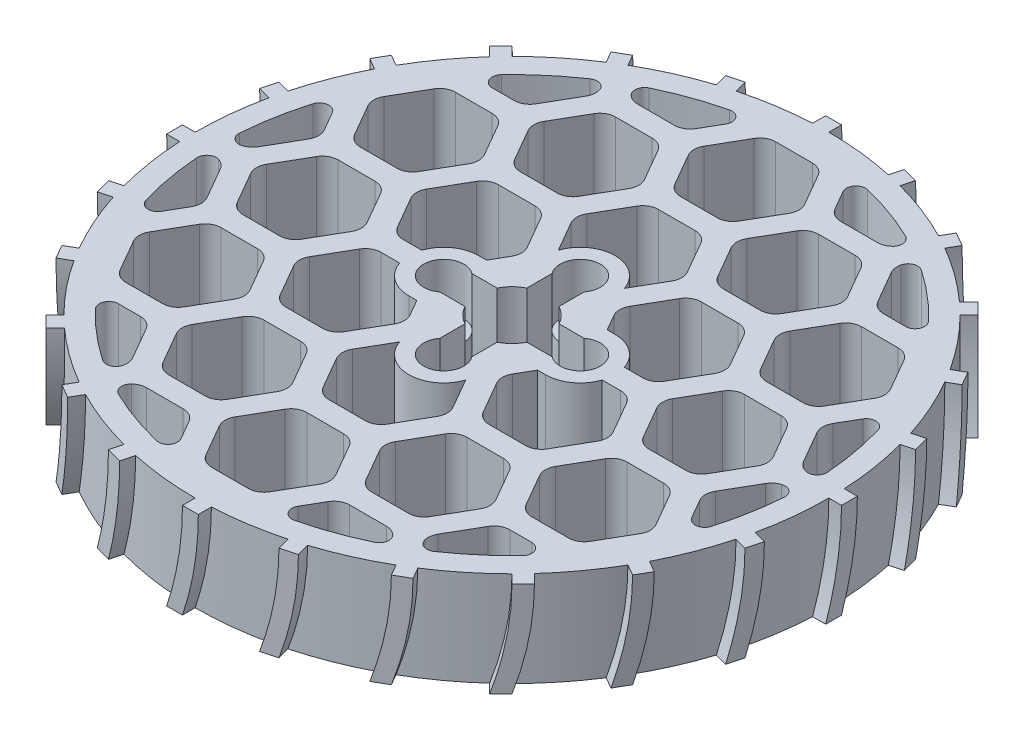
from build123d import *

# Parameters (mm, degrees)
SKETCH3_R           = 100
BOSS_EXTRUDE1_DEPTH = 30
SKETCH3_3_R         = 6.338999989
SKETCH3_3_R_2       = 3.302
BOSS_EXTRUDE2_DEPTH = 15
FILLET2_R           = 3
BOSS_EXTRUDE3_START = -2
BOSS_EXTRUDE3_DEPTH = 6
CIRPATTERN1_COUNT   = 24


with BuildPart() as part:
    # Sketch3 → Boss-Extrude1 (new body)
    with BuildSketch(Plane(origin=(0, 0, 0), x_dir=(1, 0, 0), z_dir=(0, 1, 0))):
        Circle(SKETCH3_R)
        with BuildLine():
            Line((9.767988863, 5.058299474), (17.727459802, 5.058299474))
            ThreePointArc((17.72745979, 5.05829949), (27.886999941, 1.2e-08), (17.727459809, -5.058299505))
            Line((17.727459783, -5.05829954), (9.767988829, -5.05829954))
            ThreePointArc((9.767988829, -5.05829954), (7.778174567, -7.778174619), (5.058299474, -9.767988863))
            Line((5.058299474, -9.767988863), (5.058299474, -17.727459802))
            ThreePointArc((5.05829949, -17.72745979), (1.2e-08, -27.886999941), (-5.058299505, -17.727459809))
            Line((-5.05829954, -17.727459783), (-5.05829954, -9.767988829))
            ThreePointArc((-5.05829954, -9.767988829), (-7.778174619, -7.778174567), (-9.767988863, -5.058299474))
            Line((-9.767988863, -5.058299474), (-17.727459802, -5.058299474))
            ThreePointArc((-17.72745979, -5.05829949), (-27.886999941, -1.2e-08), (-17.727459809, 5.058299505))
            Line((-17.727459783, 5.05829954), (-9.767988829, 5.05829954))
            ThreePointArc((-9.767988829, 5.05829954), (-7.778174567, 7.778174619), (-5.058299474, 9.767988863))
            Line((-5.058299474, 9.767988863), (-5.058299474, 17.727459802))
            ThreePointArc((-5.05829949, 17.72745979), (-1.2e-08, 27.886999941), (5.058299505, 17.727459809))
            Line((5.05829954, 17.727459783), (5.05829954, 9.767988829))
            ThreePointArc((5.05829954, 9.767988829), (7.778174619, 7.778174567), (9.767988863, 5.058299474))
        make_face(mode=Mode.SUBTRACT)
        with BuildLine():
            ThreePointArc((10.425269447, 25.057096364), (-7e-09, 32.547999916), (-10.425269391, 25.057096268))
            Line((-10.425269391, 25.057096268), (-15.877132403, 34.5))
            ThreePointArc((-15.877132403, 34.5), (-16.547005384, 37), (-15.877132403, 39.5))
            Line((-15.877132403, 39.5), (-10.103629711, 49.5))
            ThreePointArc((-10.103629711, 49.5), (-8.273502692, 51.330127019), (-5.773502692, 52))
            Line((-5.773502692, 52), (5.773502692, 52))
            ThreePointArc((5.773502692, 52), (8.273502692, 51.330127019), (10.103629711, 49.5))
            Line((10.103629711, 49.5), (15.877132403, 39.5))
            ThreePointArc((15.877132403, 39.5), (16.547005384, 37), (15.877132403, 34.5))
            Line((15.877132403, 34.5), (10.425269447, 25.057096364))
        make_face(mode=Mode.SUBTRACT)
        with BuildLine():
            ThreePointArc((86.025190109, 31), (86.543723708, 31.736009208), (87.185842375, 32.367095782))
            ThreePointArc((87.185842375, 32.367095782), (91.209249511, 18.162400823), (92.934116448, 3.5))
            Line((92.934116448, 3.5), (90.355317128, 3.5))
            ThreePointArc((90.355317128, 3.5), (87.855317128, 4.169872981), (86.025190109, 6))
            Line((86.025190109, 6), (80.251687417, 16))
            ThreePointArc((80.251687417, 16), (79.581814436, 18.5), (80.251687417, 21))
            Line((80.251687417, 21), (86.025190109, 31))
        make_face(mode=Mode.SUBTRACT)
        with BuildLine():
            Line((90.355317128, -3.5), (92.934116448, -3.5))
            ThreePointArc((92.934116448, -3.5), (91.209249511, -18.162400823), (87.185842375, -32.367095782))
            ThreePointArc((87.185842375, -32.367095782), (86.543723707, -31.736009208), (86.025190109, -31))
            Line((86.025190109, -31), (80.251687417, -21))
            ThreePointArc((80.251687417, -21), (79.581814436, -18.5), (80.251687417, -16))
            Line((80.251687417, -16), (86.025190109, -6))
            ThreePointArc((86.025190109, -6), (87.855317128, -4.169872981), (90.355317128, -3.5))
        make_face(mode=Mode.SUBTRACT)
        with BuildLine():
            ThreePointArc((69.859382572, -59), (70.756052043, -59.081058665), (71.623648382, -59.321606456))
            ThreePointArc((71.623648382, -59.321606456), (61.333725262, -69.908326725), (49.498147137, -78.733305722))
            Line((49.498147137, -78.733305722), (48.208747477, -76.5))
            ThreePointArc((48.208747477, -76.5), (47.538874496, -74), (48.208747477, -71.5))
            Line((48.208747477, -71.5), (53.982250169, -61.5))
            ThreePointArc((53.982250169, -61.5), (55.812377188, -59.669872981), (58.312377188, -59))
            Line((58.312377188, -59), (69.859382572, -59))
        make_face(mode=Mode.SUBTRACT)
        with BuildLine():
            Line((42.146569651, -80), (43.435969311, -82.233305722))
            ThreePointArc((43.435969311, -82.233305722), (29.875524249, -88.070727548), (15.562193993, -91.688702238))
            ThreePointArc((15.562193993, -91.688702238), (15.787671665, -90.817067873), (16.165807537, -90))
            Line((16.165807537, -90), (21.939310229, -80))
            ThreePointArc((21.939310229, -80), (23.769437248, -78.169872981), (26.269437248, -77.5))
            Line((26.269437248, -77.5), (37.816442632, -77.5))
            ThreePointArc((37.816442632, -77.5), (40.316442632, -78.169872981), (42.146569651, -80))
        make_face(mode=Mode.SUBTRACT)
        with BuildLine():
            ThreePointArc((-16.165807537, -90), (-15.787671665, -90.817067873), (-15.562193993, -91.688702238))
            ThreePointArc((-15.562193993, -91.688702238), (-29.875524249, -88.070727548), (-43.435969311, -82.233305722))
            Line((-43.435969311, -82.233305722), (-42.146569651, -80))
            ThreePointArc((-42.146569651, -80), (-40.316442632, -78.169872981), (-37.816442632, -77.5))
            Line((-37.816442632, -77.5), (-26.269437248, -77.5))
            ThreePointArc((-26.269437248, -77.5), (-23.769437248, -78.169872981), (-21.939310229, -80))
            Line((-21.939310229, -80), (-16.165807537, -90))
        make_face(mode=Mode.SUBTRACT)
        with BuildLine():
            Line((-48.208747477, -76.5), (-49.498147137, -78.733305722))
            ThreePointArc((-49.498147137, -78.733305722), (-61.333725262, -69.908326725), (-71.623648382, -59.321606456))
            ThreePointArc((-71.623648382, -59.321606456), (-70.756052043, -59.081058665), (-69.859382572, -59))
            Line((-69.859382572, -59), (-58.312377188, -59))
            ThreePointArc((-58.312377188, -59), (-55.812377188, -59.669872981), (-53.982250169, -61.5))
            Line((-53.982250169, -61.5), (-48.208747477, -71.5))
            ThreePointArc((-48.208747477, -71.5), (-47.538874496, -74), (-48.208747477, -76.5))
        make_face(mode=Mode.SUBTRACT)
        with BuildLine():
            ThreePointArc((-86.025190109, -31), (-86.543723708, -31.736009208), (-87.185842375, -32.367095782))
            ThreePointArc((-87.185842375, -32.367095782), (-91.209249511, -18.162400823), (-92.934116448, -3.5))
            Line((-92.934116448, -3.5), (-90.355317128, -3.5))
            ThreePointArc((-90.355317128, -3.5), (-87.855317128, -4.169872981), (-86.025190109, -6))
            Line((-86.025190109, -6), (-80.251687417, -16))
            ThreePointArc((-80.251687417, -16), (-79.581814436, -18.5), (-80.251687417, -21))
            Line((-80.251687417, -21), (-86.025190109, -31))
        make_face(mode=Mode.SUBTRACT)
        with BuildLine():
            Line((-90.355317128, 3.5), (-92.934116448, 3.5))
            ThreePointArc((-92.934116448, 3.5), (-91.209249511, 18.162400823), (-87.185842375, 32.367095782))
            ThreePointArc((-87.185842375, 32.367095782), (-86.543723707, 31.736009208), (-86.025190109, 31))
            Line((-86.025190109, 31), (-80.251687417, 21))
            ThreePointArc((-80.251687417, 21), (-79.581814436, 18.5), (-80.251687417, 16))
            Line((-80.251687417, 16), (-86.025190109, 6))
            ThreePointArc((-86.025190109, 6), (-87.855317128, 4.169872981), (-90.355317128, 3.5))
        make_face(mode=Mode.SUBTRACT)
        with BuildLine():
            ThreePointArc((-69.859382572, 59), (-70.756052043, 59.081058665), (-71.623648382, 59.321606456))
            ThreePointArc((-71.623648382, 59.321606456), (-61.333725262, 69.908326725), (-49.498147137, 78.733305722))
            Line((-49.498147137, 78.733305722), (-48.208747477, 76.5))
            ThreePointArc((-48.208747477, 76.5), (-47.538874496, 74), (-48.208747477, 71.5))
            Line((-48.208747477, 71.5), (-53.982250169, 61.5))
            ThreePointArc((-53.982250169, 61.5), (-55.812377188, 59.669872981), (-58.312377188, 59))
            Line((-58.312377188, 59), (-69.859382572, 59))
        make_face(mode=Mode.SUBTRACT)
        with BuildLine():
            Line((-42.146569651, 80), (-43.435969311, 82.233305722))
            ThreePointArc((-43.435969311, 82.233305722), (-29.875524249, 88.070727548), (-15.562193993, 91.688702238))
            ThreePointArc((-15.562193993, 91.688702238), (-15.787671665, 90.817067873), (-16.165807537, 90))
            Line((-16.165807537, 90), (-21.939310229, 80))
            ThreePointArc((-21.939310229, 80), (-23.769437248, 78.169872981), (-26.269437248, 77.5))
            Line((-26.269437248, 77.5), (-37.816442632, 77.5))
            ThreePointArc((-37.816442632, 77.5), (-40.316442632, 78.169872981), (-42.146569651, 80))
        make_face(mode=Mode.SUBTRACT)
        with BuildLine():
            ThreePointArc((16.165807537, 90), (15.787671665, 90.817067873), (15.562193993, 91.688702238))
            ThreePointArc((15.562193993, 91.688702238), (29.875524249, 88.070727548), (43.435969311, 82.233305722))
            Line((43.435969311, 82.233305722), (42.146569651, 80))
            ThreePointArc((42.146569651, 80), (40.316442632, 78.169872981), (37.816442632, 77.5))
            Line((37.816442632, 77.5), (26.269437248, 77.5))
            ThreePointArc((26.269437248, 77.5), (23.769437248, 78.169872981), (21.939310229, 80))
            Line((21.939310229, 80), (16.165807537, 90))
        make_face(mode=Mode.SUBTRACT)
        with BuildLine():
            Line((48.208747477, 76.5), (49.498147137, 78.733305722))
            ThreePointArc((49.498147137, 78.733305722), (61.333725262, 69.908326725), (71.623648382, 59.321606456))
            ThreePointArc((71.623648382, 59.321606456), (70.756052043, 59.081058665), (69.859382572, 59))
            Line((69.859382572, 59), (58.312377188, 59))
            ThreePointArc((58.312377188, 59), (55.812377188, 59.669872981), (53.982250169, 61.5))
            Line((53.982250169, 61.5), (48.208747477, 71.5))
            ThreePointArc((48.208747477, 71.5), (47.538874496, 74), (48.208747477, 76.5))
        make_face(mode=Mode.SUBTRACT)
        with BuildLine():
            Line((-26.269437248, -70.5), (-37.816442632, -70.5))
            ThreePointArc((-37.816442632, -70.5), (-40.316442632, -69.830127019), (-42.146569651, -68))
            Line((-42.146569651, -68), (-47.920072343, -58))
            ThreePointArc((-47.920072343, -58), (-48.589945324, -55.5), (-47.920072343, -53))
            Line((-47.920072343, -53), (-42.146569651, -43))
            ThreePointArc((-42.146569651, -43), (-40.316442632, -41.169872981), (-37.816442632, -40.5))
            Line((-37.816442632, -40.5), (-26.269437248, -40.5))
            ThreePointArc((-26.269437248, -40.5), (-23.769437248, -41.169872981), (-21.939310229, -43))
            Line((-21.939310229, -43), (-16.165807537, -53))
            ThreePointArc((-16.165807537, -53), (-15.495934556, -55.5), (-16.165807537, -58))
            Line((-16.165807537, -58), (-21.939310229, -68))
            ThreePointArc((-21.939310229, -68), (-23.769437248, -69.830127019), (-26.269437248, -70.5))
        make_face(mode=Mode.SUBTRACT)
        with BuildLine():
            Line((15.877132403, -76.5), (10.103629711, -86.5))
            ThreePointArc((10.103629711, -86.5), (8.273502692, -88.330127019), (5.773502692, -89))
            Line((5.773502692, -89), (-5.773502692, -89))
            ThreePointArc((-5.773502692, -89), (-8.273502692, -88.330127019), (-10.103629711, -86.5))
            Line((-10.103629711, -86.5), (-15.877132403, -76.5))
            ThreePointArc((-15.877132403, -76.5), (-16.547005384, -74), (-15.877132403, -71.5))
            Line((-15.877132403, -71.5), (-10.103629711, -61.5))
            ThreePointArc((-10.103629711, -61.5), (-8.273502692, -59.669872981), (-5.773502692, -59))
            Line((-5.773502692, -59), (5.773502692, -59))
            ThreePointArc((5.773502692, -59), (8.273502692, -59.669872981), (10.103629711, -61.5))
            Line((10.103629711, -61.5), (15.877132403, -71.5))
            ThreePointArc((15.877132403, -71.5), (16.547005384, -74), (15.877132403, -76.5))
        make_face(mode=Mode.SUBTRACT)
        with BuildLine():
            Line((-58.312377188, -52), (-69.859382572, -52))
            ThreePointArc((-69.859382572, -52), (-72.359382572, -51.330127019), (-74.189509591, -49.5))
            Line((-74.189509591, -49.5), (-79.963012283, -39.5))
            ThreePointArc((-79.963012283, -39.5), (-80.632885264, -37), (-79.963012283, -34.5))
            Line((-79.963012283, -34.5), (-74.189509591, -24.5))
            ThreePointArc((-74.189509591, -24.5), (-72.359382572, -22.669872981), (-69.859382572, -22))
            Line((-69.859382572, -22), (-58.312377188, -22))
            ThreePointArc((-58.312377188, -22), (-55.812377188, -22.669872981), (-53.982250169, -24.5))
            Line((-53.982250169, -24.5), (-48.208747477, -34.5))
            ThreePointArc((-48.208747477, -34.5), (-47.538874496, -37), (-48.208747477, -39.5))
            Line((-48.208747477, -39.5), (-53.982250169, -49.5))
            ThreePointArc((-53.982250169, -49.5), (-55.812377188, -51.330127019), (-58.312377188, -52))
        make_face(mode=Mode.SUBTRACT)
        with BuildLine():
            Line((-74.189509591, -12.5), (-79.963012283, -2.5))
            ThreePointArc((-79.963012283, -2.5), (-80.632885264, 0), (-79.963012283, 2.5))
            Line((-79.963012283, 2.5), (-74.189509591, 12.5))
            ThreePointArc((-74.189509591, 12.5), (-72.359382572, 14.330127019), (-69.859382572, 15))
            Line((-69.859382572, 15), (-58.312377188, 15))
            ThreePointArc((-58.312377188, 15), (-55.812377188, 14.330127019), (-53.982250169, 12.5))
            Line((-53.982250169, 12.5), (-48.208747477, 2.5))
            ThreePointArc((-48.208747477, 2.5), (-47.538874496, 0), (-48.208747477, -2.5))
            Line((-48.208747477, -2.5), (-53.982250169, -12.5))
            ThreePointArc((-53.982250169, -12.5), (-55.812377188, -14.330127019), (-58.312377188, -15))
            Line((-58.312377188, -15), (-69.859382572, -15))
            ThreePointArc((-69.859382572, -15), (-72.359382572, -14.330127019), (-74.189509591, -12.5))
        make_face(mode=Mode.SUBTRACT)
        with BuildLine():
            Line((47.920072343, -58), (42.146569651, -68))
            ThreePointArc((42.146569651, -68), (40.316442632, -69.830127019), (37.816442632, -70.5))
            Line((37.816442632, -70.5), (26.269437248, -70.5))
            ThreePointArc((26.269437248, -70.5), (23.769437248, -69.830127019), (21.939310229, -68))
            Line((21.939310229, -68), (16.165807537, -58))
            ThreePointArc((16.165807537, -58), (15.495934556, -55.5), (16.165807537, -53))
            Line((16.165807537, -53), (21.939310229, -43))
            ThreePointArc((21.939310229, -43), (23.769437248, -41.169872981), (26.269437248, -40.5))
            Line((26.269437248, -40.5), (37.816442632, -40.5))
            ThreePointArc((37.816442632, -40.5), (40.316442632, -41.169872981), (42.146569651, -43))
            Line((42.146569651, -43), (47.920072343, -53))
            ThreePointArc((47.920072343, -53), (48.589945324, -55.5), (47.920072343, -58))
        make_face(mode=Mode.SUBTRACT)
        with BuildLine():
            ThreePointArc((79.963012283, 39.5), (80.632885264, 37), (79.963012283, 34.5))
            Line((79.963012283, 34.5), (74.189509591, 24.5))
            ThreePointArc((74.189509591, 24.5), (72.359382572, 22.669872981), (69.859382572, 22))
            Line((69.859382572, 22), (58.312377188, 22))
            ThreePointArc((58.312377188, 22), (55.812377188, 22.669872981), (53.982250169, 24.5))
            Line((53.982250169, 24.5), (48.208747477, 34.5))
            ThreePointArc((48.208747477, 34.5), (47.538874496, 37), (48.208747477, 39.5))
            Line((48.208747477, 39.5), (53.982250169, 49.5))
            ThreePointArc((53.982250169, 49.5), (55.812377188, 51.330127019), (58.312377188, 52))
            Line((58.312377188, 52), (69.859382572, 52))
            ThreePointArc((69.859382572, 52), (72.359382572, 51.330127019), (74.189509591, 49.5))
            Line((74.189509591, 49.5), (79.963012283, 39.5))
        make_face(mode=Mode.SUBTRACT)
        with BuildLine():
            Line((-16.165807537, 16), (-19.052558858, 11.000000044))
            Line((-19.052558858, 11.000000044), (-21.547999916, 11.000000044))
            ThreePointArc((-21.547999916, 11.000000044), (-27.970616224, 8.93028558), (-31.976326738, 3.5))
            Line((-31.976326738, 3.5), (-37.816442632, 3.5))
            ThreePointArc((-37.816442632, 3.5), (-40.316442632, 4.169872981), (-42.146569651, 6))
            Line((-42.146569651, 6), (-47.920072343, 16))
            ThreePointArc((-47.920072343, 16), (-48.589945324, 18.5), (-47.920072343, 21))
            Line((-47.920072343, 21), (-42.146569651, 31))
            ThreePointArc((-42.146569651, 31), (-40.316442632, 32.830127019), (-37.816442632, 33.5))
            Line((-37.816442632, 33.5), (-26.269437248, 33.5))
            ThreePointArc((-26.269437248, 33.5), (-23.769437248, 32.830127019), (-21.939310229, 31))
            Line((-21.939310229, 31), (-16.165807537, 21))
            ThreePointArc((-16.165807537, 21), (-15.495934556, 18.5), (-16.165807537, 16))
        make_face(mode=Mode.SUBTRACT)
        with BuildLine():
            Line((-37.816442632, -3.5), (-31.976326709, -3.5))
            ThreePointArc((-31.976326709, -3.5), (-27.970616186, -8.930285519), (-21.547999916, -10.999999956))
            Line((-21.547999916, -10.999999956), (-19.052558909, -10.999999956))
            Line((-19.052558909, -10.999999956), (-16.165807537, -16))
            ThreePointArc((-16.165807537, -16), (-15.495934556, -18.5), (-16.165807537, -21))
            Line((-16.165807537, -21), (-21.939310229, -31))
            ThreePointArc((-21.939310229, -31), (-23.769437248, -32.830127019), (-26.269437248, -33.5))
            Line((-26.269437248, -33.5), (-37.816442632, -33.5))
            ThreePointArc((-37.816442632, -33.5), (-40.316442632, -32.830127019), (-42.146569651, -31))
            Line((-42.146569651, -31), (-47.920072343, -21))
            ThreePointArc((-47.920072343, -21), (-48.589945324, -18.5), (-47.920072343, -16))
            Line((-47.920072343, -16), (-42.146569651, -6))
            ThreePointArc((-42.146569651, -6), (-40.316442632, -4.169872981), (-37.816442632, -3.5))
        make_face(mode=Mode.SUBTRACT)
        with BuildLine():
            Line((-15.877132403, -34.5), (-10.425269447, -25.057096364))
            ThreePointArc((-10.425269447, -25.057096364), (7e-09, -32.547999916), (10.425269391, -25.057096268))
            Line((10.425269391, -25.057096268), (15.877132403, -34.5))
            ThreePointArc((15.877132403, -34.5), (16.547005384, -37), (15.877132403, -39.5))
            Line((15.877132403, -39.5), (10.103629711, -49.5))
            ThreePointArc((10.103629711, -49.5), (8.273502692, -51.330127019), (5.773502692, -52))
            Line((5.773502692, -52), (-5.773502692, -52))
            ThreePointArc((-5.773502692, -52), (-8.273502692, -51.330127019), (-10.103629711, -49.5))
            Line((-10.103629711, -49.5), (-15.877132403, -39.5))
            ThreePointArc((-15.877132403, -39.5), (-16.547005384, -37), (-15.877132403, -34.5))
        make_face(mode=Mode.SUBTRACT)
        with BuildLine():
            Line((16.165807537, -16), (19.052558858, -11.000000044))
            Line((19.052558858, -11.000000044), (21.547999916, -11.000000044))
            ThreePointArc((21.547999916, -11.000000044), (27.970616224, -8.93028558), (31.976326738, -3.5))
            Line((31.976326738, -3.5), (37.816442632, -3.5))
            ThreePointArc((37.816442632, -3.5), (40.316442632, -4.169872981), (42.146569651, -6))
            Line((42.146569651, -6), (47.920072343, -16))
            ThreePointArc((47.920072343, -16), (48.589945324, -18.5), (47.920072343, -21))
            Line((47.920072343, -21), (42.146569651, -31))
            ThreePointArc((42.146569651, -31), (40.316442632, -32.830127019), (37.816442632, -33.5))
            Line((37.816442632, -33.5), (26.269437248, -33.5))
            ThreePointArc((26.269437248, -33.5), (23.769437248, -32.830127019), (21.939310229, -31))
            Line((21.939310229, -31), (16.165807537, -21))
            ThreePointArc((16.165807537, -21), (15.495934556, -18.5), (16.165807537, -16))
        make_face(mode=Mode.SUBTRACT)
        with BuildLine():
            Line((37.816442632, 3.5), (31.976326709, 3.5))
            ThreePointArc((31.976326709, 3.5), (27.970616186, 8.930285519), (21.547999916, 10.999999956))
            Line((21.547999916, 10.999999956), (19.052558909, 10.999999956))
            Line((19.052558909, 10.999999956), (16.165807537, 16))
            ThreePointArc((16.165807537, 16), (15.495934556, 18.5), (16.165807537, 21))
            Line((16.165807537, 21), (21.939310229, 31))
            ThreePointArc((21.939310229, 31), (23.769437248, 32.830127019), (26.269437248, 33.5))
            Line((26.269437248, 33.5), (37.816442632, 33.5))
            ThreePointArc((37.816442632, 33.5), (40.316442632, 32.830127019), (42.146569651, 31))
            Line((42.146569651, 31), (47.920072343, 21))
            ThreePointArc((47.920072343, 21), (48.589945324, 18.5), (47.920072343, 16))
            Line((47.920072343, 16), (42.146569651, 6))
            ThreePointArc((42.146569651, 6), (40.316442632, 4.169872981), (37.816442632, 3.5))
        make_face(mode=Mode.SUBTRACT)
        with BuildLine():
            Line((74.189509591, -24.5), (79.963012283, -34.5))
            ThreePointArc((79.963012283, -34.5), (80.632885264, -37), (79.963012283, -39.5))
            Line((79.963012283, -39.5), (74.189509591, -49.5))
            ThreePointArc((74.189509591, -49.5), (72.359382572, -51.330127019), (69.859382572, -52))
            Line((69.859382572, -52), (58.312377188, -52))
            ThreePointArc((58.312377188, -52), (55.812377188, -51.330127019), (53.982250169, -49.5))
            Line((53.982250169, -49.5), (48.208747477, -39.5))
            ThreePointArc((48.208747477, -39.5), (47.538874496, -37), (48.208747477, -34.5))
            Line((48.208747477, -34.5), (53.982250169, -24.5))
            ThreePointArc((53.982250169, -24.5), (55.812377188, -22.669872981), (58.312377188, -22))
            Line((58.312377188, -22), (69.859382572, -22))
            ThreePointArc((69.859382572, -22), (72.359382572, -22.669872981), (74.189509591, -24.5))
        make_face(mode=Mode.SUBTRACT)
        with BuildLine():
            Line((74.189509591, 12.5), (79.963012283, 2.5))
            ThreePointArc((79.963012283, 2.5), (80.632885264, 0), (79.963012283, -2.5))
            Line((79.963012283, -2.5), (74.189509591, -12.5))
            ThreePointArc((74.189509591, -12.5), (72.359382572, -14.330127019), (69.859382572, -15))
            Line((69.859382572, -15), (58.312377188, -15))
            ThreePointArc((58.312377188, -15), (55.812377188, -14.330127019), (53.982250169, -12.5))
            Line((53.982250169, -12.5), (48.208747477, -2.5))
            ThreePointArc((48.208747477, -2.5), (47.538874496, 0), (48.208747477, 2.5))
            Line((48.208747477, 2.5), (53.982250169, 12.5))
            ThreePointArc((53.982250169, 12.5), (55.812377188, 14.330127019), (58.312377188, 15))
            Line((58.312377188, 15), (69.859382572, 15))
            ThreePointArc((69.859382572, 15), (72.359382572, 14.330127019), (74.189509591, 12.5))
        make_face(mode=Mode.SUBTRACT)
        with BuildLine():
            Line((-74.189509591, 24.5), (-79.963012283, 34.5))
            ThreePointArc((-79.963012283, 34.5), (-80.632885264, 37), (-79.963012283, 39.5))
            Line((-79.963012283, 39.5), (-74.189509591, 49.5))
            ThreePointArc((-74.189509591, 49.5), (-72.359382572, 51.330127019), (-69.859382572, 52))
            Line((-69.859382572, 52), (-58.312377188, 52))
            ThreePointArc((-58.312377188, 52), (-55.812377188, 51.330127019), (-53.982250169, 49.5))
            Line((-53.982250169, 49.5), (-48.208747477, 39.5))
            ThreePointArc((-48.208747477, 39.5), (-47.538874496, 37), (-48.208747477, 34.5))
            Line((-48.208747477, 34.5), (-53.982250169, 24.5))
            ThreePointArc((-53.982250169, 24.5), (-55.812377188, 22.669872981), (-58.312377188, 22))
            Line((-58.312377188, 22), (-69.859382572, 22))
            ThreePointArc((-69.859382572, 22), (-72.359382572, 22.669872981), (-74.189509591, 24.5))
        make_face(mode=Mode.SUBTRACT)
        with BuildLine():
            Line((-47.920072343, 58), (-42.146569651, 68))
            ThreePointArc((-42.146569651, 68), (-40.316442632, 69.830127019), (-37.816442632, 70.5))
            Line((-37.816442632, 70.5), (-26.269437248, 70.5))
            ThreePointArc((-26.269437248, 70.5), (-23.769437248, 69.830127019), (-21.939310229, 68))
            Line((-21.939310229, 68), (-16.165807537, 58))
            ThreePointArc((-16.165807537, 58), (-15.495934556, 55.5), (-16.165807537, 53))
            Line((-16.165807537, 53), (-21.939310229, 43))
            ThreePointArc((-21.939310229, 43), (-23.769437248, 41.169872981), (-26.269437248, 40.5))
            Line((-26.269437248, 40.5), (-37.816442632, 40.5))
            ThreePointArc((-37.816442632, 40.5), (-40.316442632, 41.169872981), (-42.146569651, 43))
            Line((-42.146569651, 43), (-47.920072343, 53))
            ThreePointArc((-47.920072343, 53), (-48.589945324, 55.5), (-47.920072343, 58))
        make_face(mode=Mode.SUBTRACT)
        with BuildLine():
            Line((26.269437248, 70.5), (37.816442632, 70.5))
            ThreePointArc((37.816442632, 70.5), (40.316442632, 69.830127019), (42.146569651, 68))
            Line((42.146569651, 68), (47.920072343, 58))
            ThreePointArc((47.920072343, 58), (48.589945324, 55.5), (47.920072343, 53))
            Line((47.920072343, 53), (42.146569651, 43))
            ThreePointArc((42.146569651, 43), (40.316442632, 41.169872981), (37.816442632, 40.5))
            Line((37.816442632, 40.5), (26.269437248, 40.5))
            ThreePointArc((26.269437248, 40.5), (23.769437248, 41.169872981), (21.939310229, 43))
            Line((21.939310229, 43), (16.165807537, 53))
            ThreePointArc((16.165807537, 53), (15.495934556, 55.5), (16.165807537, 58))
            Line((16.165807537, 58), (21.939310229, 68))
            ThreePointArc((21.939310229, 68), (23.769437248, 69.830127019), (26.269437248, 70.5))
        make_face(mode=Mode.SUBTRACT)
        with BuildLine():
            Line((-5.773502692, 89), (5.773502692, 89))
            ThreePointArc((5.773502692, 89), (8.273502692, 88.330127019), (10.103629711, 86.5))
            Line((10.103629711, 86.5), (15.877132403, 76.5))
            ThreePointArc((15.877132403, 76.5), (16.547005384, 74), (15.877132403, 71.5))
            Line((15.877132403, 71.5), (10.103629711, 61.5))
            ThreePointArc((10.103629711, 61.5), (8.273502692, 59.669872981), (5.773502692, 59))
            Line((5.773502692, 59), (-5.773502692, 59))
            ThreePointArc((-5.773502692, 59), (-8.273502692, 59.669872981), (-10.103629711, 61.5))
            Line((-10.103629711, 61.5), (-15.877132403, 71.5))
            ThreePointArc((-15.877132403, 71.5), (-16.547005384, 74), (-15.877132403, 76.5))
            Line((-15.877132403, 76.5), (-10.103629711, 86.5))
            ThreePointArc((-10.103629711, 86.5), (-8.273502692, 88.330127019), (-5.773502692, 89))
        make_face(mode=Mode.SUBTRACT)
    extrude(amount=BOSS_EXTRUDE1_DEPTH)

    # Sketch3<3> → Boss-Extrude2 (add)
    # profile 1 of 4: a face of its own
    with BuildSketch(Plane(origin=(0, 0, 0), x_dir=(1, 0, 0), z_dir=(0, 1, 0))):
        with Locations((0, 21.547999952)):
            Circle(SKETCH3_3_R)
        with Locations((4.4e-08, 21.547999942)):
            Circle(SKETCH3_3_R_2, mode=Mode.SUBTRACT)
    # profile 2 of 4: a face of its own
    with BuildSketch(Plane(origin=(0, 0, 0), x_dir=(1, 0, 0), z_dir=(0, 1, 0))):
        with Locations((21.547999952, 0)):
            Circle(SKETCH3_3_R)
        with Locations((21.547999942, -4.4e-08)):
            Circle(SKETCH3_3_R_2, mode=Mode.SUBTRACT)
    # profile 3 of 4: a face of its own
    with BuildSketch(Plane(origin=(0, 0, 0), x_dir=(1, 0, 0), z_dir=(0, 1, 0))):
        with Locations((-21.547999952, 0)):
            Circle(SKETCH3_3_R)
        with Locations((-21.547999942, 4.4e-08)):
            Circle(SKETCH3_3_R_2, mode=Mode.SUBTRACT)
    # profile 4 of 4: a face of its own
    with BuildSketch(Plane(origin=(0, 0, 0), x_dir=(1, 0, 0), z_dir=(0, 1, 0))):
        with Locations((0, -21.547999952)):
            Circle(SKETCH3_3_R)
        with Locations((-4.4e-08, -21.547999942)):
            Circle(SKETCH3_3_R_2, mode=Mode.SUBTRACT)
    extrude(amount=BOSS_EXTRUDE2_DEPTH)

    # Fillet2
    fillet2_edges = [part.edges().sort_by_distance(p)[0] for p in [
        (92.934116448, 15, -3.5),
        (87.185842375, 15, -32.367095782),
        (92.934116448, 15, 3.5),
        (87.185842375, 15, 32.367095782),
        (71.623648382, 15, 59.321606456),
        (49.498147137, 15, 78.733305722),
        (43.435969311, 15, 82.233305722),
        (15.562193993, 15, 91.688702238),
        (-15.562193993, 15, 91.688702238),
        (-43.435969311, 15, 82.233305722),
        (-49.498147137, 15, 78.733305722),
        (-71.623648382, 15, 59.321606456),
        (-87.185842375, 15, 32.367095782),
        (-92.934116448, 15, 3.5),
        (-92.934116448, 15, -3.5),
        (-87.185842375, 15, -32.367095782),
        (-43.435969311, 15, -82.233305722),
        (-49.498147137, 15, -78.733305722),
        (-71.623648382, 15, -59.321606456),
        (-15.562193993, 15, -91.688702238),
        (15.562193993, 15, -91.688702238),
        (43.435969311, 15, -82.233305722),
        (49.498147137, 15, -78.733305722),
        (71.623648382, 15, -59.321606456),
    ]]
    fillet(fillet2_edges, radius=FILLET2_R)

    # Sketch4 → Boss-Extrude3 (add)
    with BuildSketch(Plane(origin=(100, 0, 0), x_dir=(0, 0, -1), z_dir=(1, 0, 0)).offset(BOSS_EXTRUDE3_START)):
        with BuildLine():
            Line((5, 30), (0, 30))
            add(Edge.make_bspline(
                [(0, 30), (0, 15), (-5, 0)],
                knots=[0.5, 0.5, 0.5, 1, 1, 1], degree=2))
            Line((-5, 0), (0, 0))
            add(Edge.make_bspline(
                [(0, 0), (5, 15), (5, 30)],
                knots=[0, 0, 0, 0.5, 0.5, 0.5], degree=2))
        make_face()
    boss_extrude3 = extrude(amount=BOSS_EXTRUDE3_DEPTH)

    # CirPattern1: Boss-Extrude3 ×24 about axis
    cirpattern1_axis = Axis((0, 30, 0), (0, -1, 0))
    for i in range(1, CIRPATTERN1_COUNT):
        add(boss_extrude3.rotate(cirpattern1_axis, i * 360 / CIRPATTERN1_COUNT))


solid = part.part
